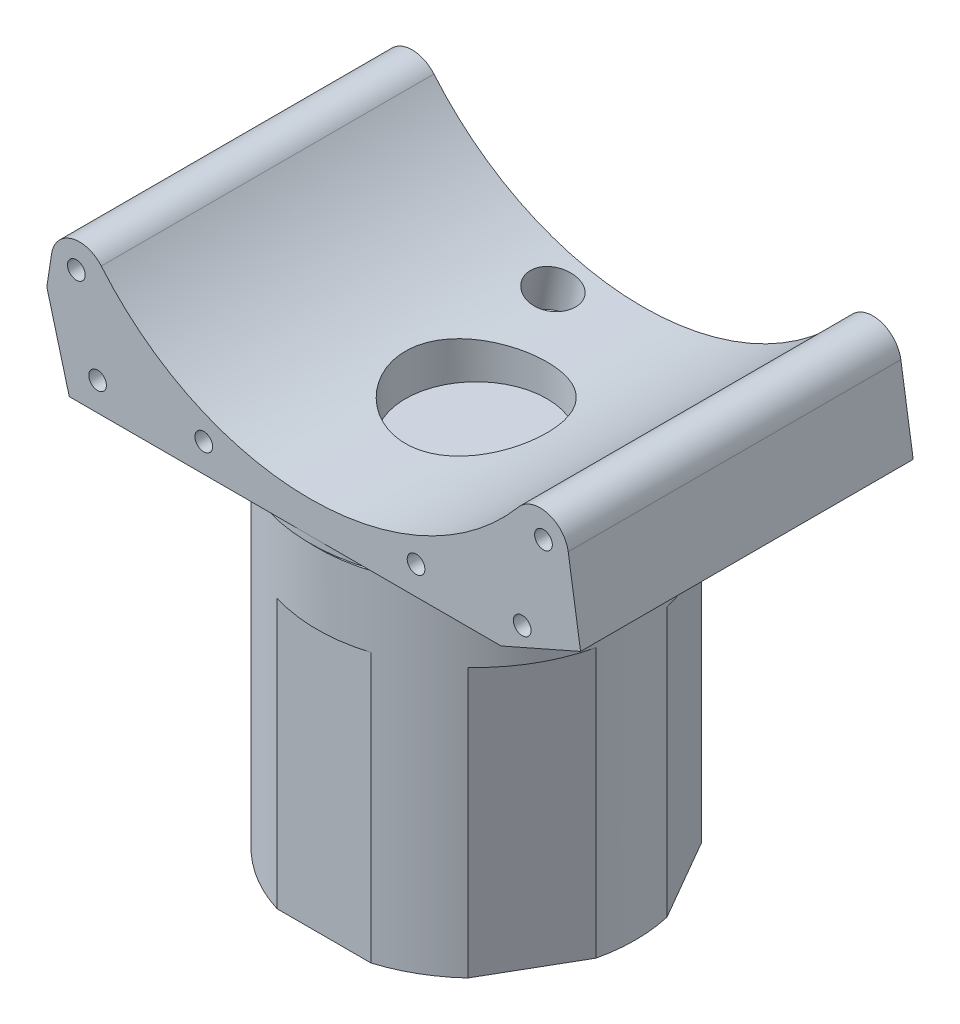
from build123d import *

# Parameters (mm, degrees)
EXTRUSION1_DEPTH      = 23.5
EXTRUSION1_DEPTH_BACK = 23.5
SKETCH2_R             = 10
EXTRUSION2_DEPTH      = 50.596873889
SKETCH3_R             = 23.45
EXTRUSION3_DEPTH      = 1
EXTRUSION4_START      = 48
SKETCH4_R             = 22.5
SKETCH4_R_2           = 10
EXTRUSION4_DEPTH      = 48
HOLE1_AT_2_COUNT      = 2
HOLE1_AT_2_PITCH      = 21.633307653
HOLE1_AT_3_COUNT      = 2
HOLE1_AT_3_PITCH      = 49.477267507
HOLE1_AT_4_COUNT      = 2
HOLE1_AT_4_PITCH      = 66
HOLE1_AT_5_COUNT      = 2
HOLE1_AT_5_PITCH      = 12.369316877
HOLE1_AT_6_COUNT      = 2
HOLE1_AT_6_PITCH      = 64.132674979
SKETCH7_R             = 30
EXTRUSION5_DEPTH      = 38
CHAMFER1_SIZE         = 5
CHAMFER1_SIZE2        = 11.989032452
CHAMFER2_SIZE         = 5
CHAMFER2_SIZE2        = 11.989032452
HOLE2_START           = -34.264861782
HOLE2_DEPTH           = 12.137420641
HOLE2_START_2         = -60.712668103
HOLE2_2_DEPTH         = 26.447806321
FILLET1_R             = 0.5


# Read off the part's stored shape, not the designer's step: Hole2
with BuildPart() as part:
    # Sketch1 → Extrusion1 (new, two sides: drawn at the far end of the back side and taken through both)
    with BuildSketch(Plane.XY.offset(-EXTRUSION1_DEPTH_BACK)):
        with BuildLine():
            Line((-39, -26.434221649), (39, -26.434221649))
            Line((39, -26.434221649), (36.494000722, -10.163193034))
            ThreePointArc((36.494000722, -10.163193034), (33.618931472, -6.920164876), (29.47796881, -8.199103132))
            ThreePointArc((29.47796881, -8.199103132), (0, -21.934221649), (-29.47796881, -8.199103132))
            ThreePointArc((-29.47796881, -8.199103132), (-33.618931472, -6.920164876), (-36.494000722, -10.163193034))
            Line((-36.494000722, -10.163193034), (-39, -26.434221649))
        make_face()
    extrude(amount=EXTRUSION1_DEPTH + EXTRUSION1_DEPTH_BACK)

    # Sketch2 → Extrusion2 (cut, through all)
    with BuildSketch(Plane.XZ.offset(26.434221649)):
        with Locations(Location((0, 0, 0), (0, 0, 270))):
            Circle(SKETCH2_R)
    extrude(amount=-EXTRUSION2_DEPTH, mode=Mode.SUBTRACT)

    # Sketch3 → Extrusion3 (add)
    with BuildSketch(Plane.XZ.offset(26.434221649)):
        with Locations(Location((0, 0, 0), (0, 0, 270))):
            Circle(SKETCH3_R)
    extrude(amount=EXTRUSION3_DEPTH)

    # Sketch5 → Hole1 (revolve, cut)
    with BuildSketch(Plane(origin=(-33, -10.434221649, 23.5), x_dir=(0, -1, 0), z_dir=(1, 0, 0))):
        Polygon((0, 0), (0, 8.751075774), (1.25, 8), (1.25, 0), align=None)
    hole1 = revolve(axis=Axis((-33, -10.434221649, 27.744199587), (0, 0, -1)), mode=Mode.SUBTRACT)

    # Hole1 at 2: Hole1 ×2
    with Locations(*[Vector(0.8320502943378437, -0.5547001962252293, 0) * (i * HOLE1_AT_2_PITCH) for i in range(1, HOLE1_AT_2_COUNT)]):
        add(hole1, mode=Mode.SUBTRACT)

    # Hole1 at 3: Hole1 ×2
    with Locations(*[Vector(0.970142500145332, -0.24253562503633302, 0) * (i * HOLE1_AT_3_PITCH) for i in range(1, HOLE1_AT_3_COUNT)]):
        add(hole1, mode=Mode.SUBTRACT)

    # Hole1 at 4: Hole1 ×2
    with Locations(*[(i * HOLE1_AT_4_PITCH, 0, 0) for i in range(1, HOLE1_AT_4_COUNT)]):
        add(hole1, mode=Mode.SUBTRACT)

    # Hole1 at 5: Hole1 ×2
    with Locations(*[Vector(0.24253562503633294, -0.9701425001453319, 0) * (i * HOLE1_AT_5_PITCH) for i in range(1, HOLE1_AT_5_COUNT)]):
        add(hole1, mode=Mode.SUBTRACT)

    # Hole1 at 6: Hole1 ×2
    with Locations(*[Vector(0.9823385664224747, -0.18711210788999522, 0) * (i * HOLE1_AT_6_PITCH) for i in range(1, HOLE1_AT_6_COUNT)]):
        add(hole1, mode=Mode.SUBTRACT)

    # Chamfer1
    chamfer1_edges = [part.edges().sort_by_distance(p)[0] for p in [
        (-39, -26.434221649, 0),
    ]]
    chamfer1_side = [part.faces().sort_by_distance(p)[0] for p in [
        (-38.089340898, -26.434221649, 0),
    ]]
    chamfer(chamfer1_edges, length=CHAMFER1_SIZE, length2=CHAMFER1_SIZE2, reference=chamfer1_side[0])

    # Chamfer2
    chamfer2_edges = [part.edges().sort_by_distance(p)[0] for p in [
        (39, -26.434221649, 0),
    ]]
    chamfer2_side = [part.faces().sort_by_distance(p)[0] for p in [
        (37.747000361, -18.298707341, 0),
    ]]
    chamfer(chamfer2_edges, length=CHAMFER2_SIZE, length2=CHAMFER2_SIZE2, reference=chamfer2_side[0])

    # Mirror1: Hole1 across plane
    add(hole1.mirror(Plane.XY), mode=Mode.SUBTRACT)

    # Mirror1 copy 1 sketch → Mirror1 copy 1 (revolve, cut)
    with BuildSketch(Plane(origin=(-15, -22.434221649, -23.5), x_dir=(0, -1, 0), z_dir=(1, 0, 0))):
        Polygon((0, 0), (0, -8.751075774), (1.25, -8), (1.25, 0), align=None)
    revolve(axis=Axis((-15, -22.434221649, -27.744199587), (0, 0, -1)), mode=Mode.SUBTRACT)

    # Mirror1 copy 2 sketch → Mirror1 copy 2 (revolve, cut)
    with BuildSketch(Plane(origin=(15, -22.434221649, -23.5), x_dir=(0, -1, 0), z_dir=(1, 0, 0))):
        Polygon((0, 0), (0, -8.751075774), (1.25, -8), (1.25, 0), align=None)
    revolve(axis=Axis((15, -22.434221649, -27.744199587), (0, 0, -1)), mode=Mode.SUBTRACT)

    # Mirror1 copy 3 sketch → Mirror1 copy 3 (revolve, cut)
    with BuildSketch(Plane(origin=(33, -10.434221649, -23.5), x_dir=(0, -1, 0), z_dir=(1, 0, 0))):
        Polygon((0, 0), (0, -8.751075774), (1.25, -8), (1.25, 0), align=None)
    revolve(axis=Axis((33, -10.434221649, -27.744199587), (0, 0, -1)), mode=Mode.SUBTRACT)

    # Mirror1 copy 4 sketch → Mirror1 copy 4 (revolve, cut)
    with BuildSketch(Plane(origin=(-30, -22.434221649, -23.5), x_dir=(0, -1, 0), z_dir=(1, 0, 0))):
        Polygon((0, 0), (0, -8.751075774), (1.25, -8), (1.25, 0), align=None)
    revolve(axis=Axis((-30, -22.434221649, -27.744199587), (0, 0, -1)), mode=Mode.SUBTRACT)

    # Mirror1 copy 5 sketch → Mirror1 copy 5 (revolve, cut)
    with BuildSketch(Plane(origin=(30, -22.434221649, -23.5), x_dir=(0, -1, 0), z_dir=(1, 0, 0))):
        Polygon((0, 0), (0, -8.751075774), (1.25, -8), (1.25, 0), align=None)
    revolve(axis=Axis((30, -22.434221649, -27.744199587), (0, 0, -1)), mode=Mode.SUBTRACT)


with BuildPart() as body_2:
    # Sketch4 → Extrusion4 (new body)
    with BuildSketch(Plane.XZ.offset(28.421676964).offset(EXTRUSION4_START)):
        with Locations(Location((0, 0, 0), (0, 0, 90))):
            Circle(SKETCH4_R)
        with Locations(Location((0, 0, 0), (0, 0, 90))):
            Circle(SKETCH4_R_2, mode=Mode.SUBTRACT)
    extrude(amount=-EXTRUSION4_DEPTH)

    # Sketch7 → Extrusion5 (cut)
    with BuildSketch(Plane.XZ.offset(76.421676964)):
        Circle(SKETCH7_R)
        Polygon((12.413030788, -21.5), (-12.413030788, -21.5), (-24.826061575, 0), (-12.413030788, 21.5), (12.413030788, 21.5), (24.826061575, 0), align=None, mode=Mode.SUBTRACT)
    extrude(amount=-EXTRUSION5_DEPTH, mode=Mode.SUBTRACT)


with BuildPart() as hole2_tool:
    # Hole2 outline → Hole2 (new body)
    with BuildSketch(Plane(origin=(0, 0, 0), x_dir=(0.980040772878097, -0.19879658824160507, 0), z_dir=(0.19879658824160504, 0.9800407728780971, 0)).offset(HOLE2_START)):
        with BuildLine():
            ThreePointArc((-6.531345601, 18.755158669), (-1.826697464, 15.577278424), (-1.597305707, 21.250021708))
            ThreePointArc((-1.597305707, 21.250021708), (-4.759742972, 21.377902876), (-6.531345601, 18.755158669))
        make_face()
    extrude(amount=HOLE2_DEPTH)


with BuildPart() as part_1:
    add(part.part)

    # Hole2: cut by hole2_tool
    add(hole2_tool.part, mode=Mode.SUBTRACT)


with BuildPart() as body_2_1:
    add(body_2.part)

    # Hole2: cut by hole2_tool
    add(hole2_tool.part, mode=Mode.SUBTRACT)

    # Hole2 2 outline → Hole2 2 (cut)
    with BuildSketch(Plane(origin=(0, 0, 0), x_dir=(0.980040772878097, -0.19879658824160507, 0), z_dir=(0.19879658824160504, 0.9800407728780971, 0)).offset(HOLE2_START_2)):
        with BuildLine():
            Line((-3.751585242, 19.905841855), (-4.007929232, 19.823574031))
            Line((-4.007929232, 19.823574031), (-4.219663776, 19.657294992))
            ThreePointArc((-4.219663776, 19.657294992), (-2.589751963, 17.152776545), (-3.751585242, 19.905841855))
        make_face()
    extrude(amount=HOLE2_2_DEPTH, mode=Mode.SUBTRACT)

    # Fillet1
    fillet1_edges = [body_2_1.edges().sort_by_distance(p)[0] for p in [
        (-7.6463757, -28.421676964, -15.568779715),
    ]]
    fillet(fillet1_edges, radius=FILLET1_R)


solid = Compound([part_1.part, body_2_1.part])
